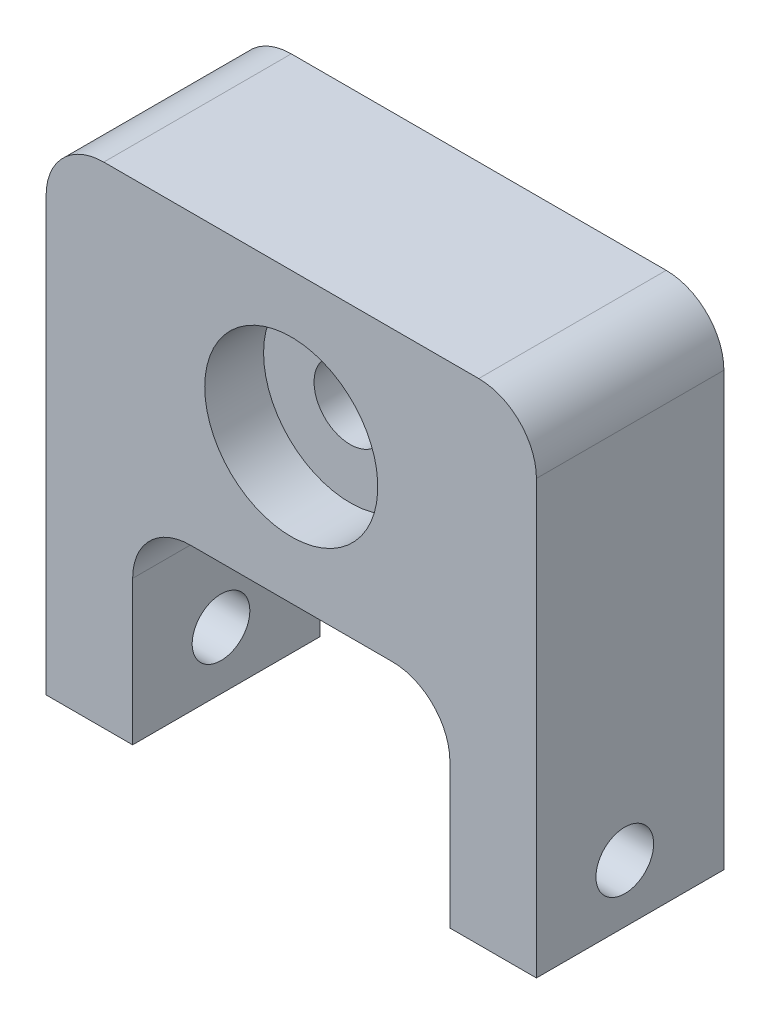
from build123d import *

# Parameters (mm, degrees)
SKETCH1_W           = 53.975
SKETCH1_H           = 31.75
BOSS_EXTRUDE1_DEPTH = 20.6375
SKETCH2_R           = 11.1125
CUT_EXTRUDE1_DEPTH  = 6.985
SKETCH3_R           = 8.255
CUT_EXTRUDE2_DEPTH  = 2.413
SKETCH4_R           = 3.96875
CUT_EXTRUDE3_DEPTH  = 34.266607003
CUT_EXTRUDE4_START  = -4.7625
SKETCH6_R           = 9.525
CUT_EXTRUDE4_DEPTH  = 29.504107003
SKETCH7_W           = 9.525
SKETCH7_H           = 20.6375
BOSS_EXTRUDE2_DEPTH = 22.225
SKETCH9_R           = 3.175
CUT_EXTRUDE5_DEPTH  = 70.215728207
FILLET1_R           = 6.35


with BuildPart() as part:
    # Sketch1 → Boss-Extrude1 (new body)
    with BuildSketch(Plane.XY):
        Rectangle(SKETCH1_W, SKETCH1_H)
    extrude(amount=BOSS_EXTRUDE1_DEPTH)

    # Sketch2 → Cut-Extrude1 (cut)
    with BuildSketch(Plane(origin=(0, 0, 0), x_dir=(-1, 0, 0), z_dir=(0, 0, -1))):
        Circle(SKETCH2_R)
    extrude(amount=-CUT_EXTRUDE1_DEPTH, mode=Mode.SUBTRACT)

    # Sketch3 → Cut-Extrude2 (cut)
    with BuildSketch(Plane(origin=(0, 0, 6.985), x_dir=(-1, 0, 0), z_dir=(0, 0, -1))):
        Circle(SKETCH3_R)
    extrude(amount=-CUT_EXTRUDE2_DEPTH, mode=Mode.SUBTRACT)

    # Sketch4 → Cut-Extrude3 (cut, through all)
    with BuildSketch(Plane(origin=(0, 0, 9.398), x_dir=(-1, 0, 0), z_dir=(0, 0, -1))):
        Circle(SKETCH4_R)
    extrude(amount=-CUT_EXTRUDE3_DEPTH, mode=Mode.SUBTRACT)

    # Sketch6 → Cut-Extrude4 (cut, through all)
    with BuildSketch(Plane(origin=(0, 0, 9.398), x_dir=(-1, 0, 0), z_dir=(0, 0, -1)).offset(CUT_EXTRUDE4_START)):
        Circle(SKETCH6_R)
    extrude(amount=-CUT_EXTRUDE4_DEPTH, mode=Mode.SUBTRACT)

    # Sketch7 → Boss-Extrude2 (add)
    with BuildSketch(Plane.XZ.offset(15.875)):
        with Locations((-22.225, 10.31875)):
            Rectangle(SKETCH7_W, SKETCH7_H)
        with Locations((22.225, 10.31875)):
            Rectangle(SKETCH7_W, SKETCH7_H)
    extrude(amount=BOSS_EXTRUDE2_DEPTH)

    # Sketch9 → Cut-Extrude5 (cut, through all)
    with BuildSketch(Plane(origin=(26.9875, 0, 0), x_dir=(0, 0, -1), z_dir=(1, 0, 0))):
        with Locations((-10.909520599, -31.75)):
            Circle(SKETCH9_R)
    extrude(amount=-CUT_EXTRUDE5_DEPTH, mode=Mode.SUBTRACT)

    # Fillet1
    fillet1_edges = [part.edges().sort_by_distance(p)[0] for p in [
        (26.9875, 15.875, 10.31875),
        (-26.9875, 15.875, 10.31875),
        (17.4625, -15.875, 10.31875),
        (-17.4625, -15.875, 10.31875),
    ]]
    fillet(fillet1_edges, radius=FILLET1_R)


solid = part.part
